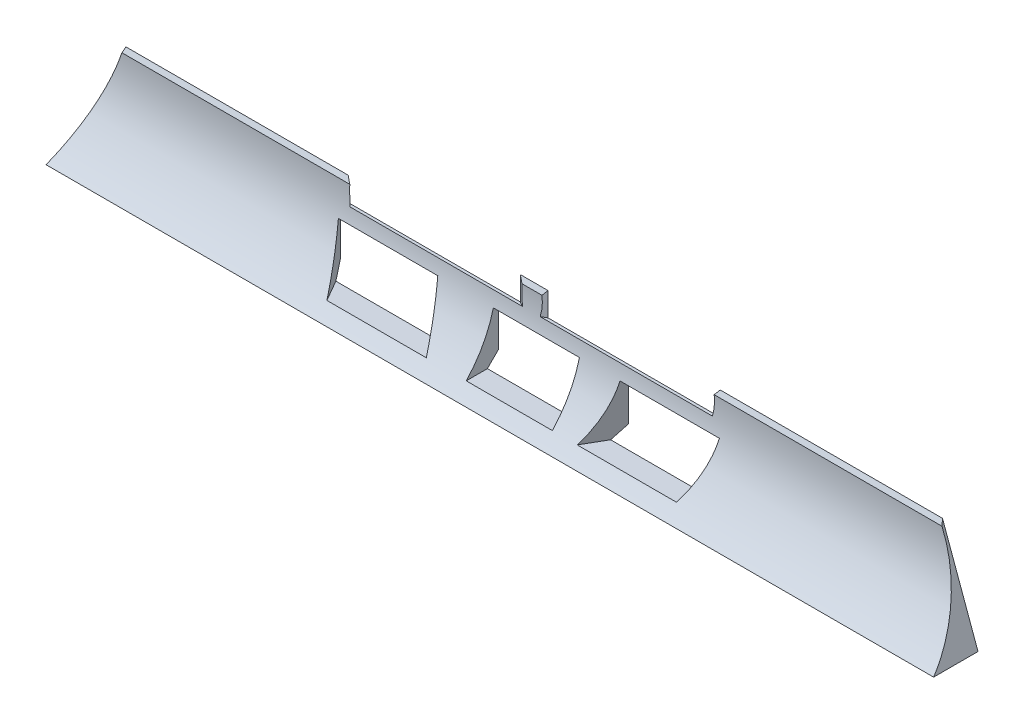
from build123d import *

# Parameters (mm, degrees)
BOSS_EXTRUDE1_DEPTH = 200
CUT_EXTRUDE1_DEPTH  = 202.45470955
CUT_EXTRUDE2_DEPTH  = 202.45470955
BOSS_EXTRUDE2_REACH = 203.455
SKETCH5_W           = 3
SKETCH5_H           = 5
CUT_EXTRUDE3_DEPTH  = 202.45470955
CUT_EXTRUDE4_DEPTH  = 1.8
SKETCH9_W           = 19.4
SKETCH9_H           = 11.2
CUT_EXTRUDE6_DEPTH  = 202.45470955
CUT_EXTRUDE8_START  = -6.8
SKETCH10_W          = 19.4
SKETCH10_H          = 11.2
CUT_EXTRUDE8_DEPTH  = 22.6
SKETCH11_W          = 19.4
SKETCH11_H          = 12.8
CUT_EXTRUDE9_DEPTH  = 97.8


with BuildPart() as part:
    # Sketch1 → Boss-Extrude1 (new body)
    with BuildSketch(Plane(origin=(0, 0, 0), x_dir=(0, 0, -1), z_dir=(1, 0, 0))):
        Polygon((0, 0), (-10, 0), (0, 22), align=None)
    extrude(amount=BOSS_EXTRUDE1_DEPTH)

    # Sketch2 → Cut-Extrude1 (cut, through all)
    with BuildSketch(Plane(origin=(200, 0, 0), x_dir=(0, 0, -1), z_dir=(1, 0, 0))):
        with BuildLine():
            Line((-10, 0), (-0.5, 20.9))
            ThreePointArc((-0.5, 20.9), (-2.709071222, 9.295032374), (-10, 0))
        make_face()
    extrude(amount=-CUT_EXTRUDE1_DEPTH, mode=Mode.SUBTRACT)

    # Sketch4 → Cut-Extrude2 (cut, through all)
    with BuildSketch(Plane(origin=(200, 0, 0), x_dir=(0, 0, -1), z_dir=(1, 0, 0))):
        Polygon((-5, 0), (0, 5), (0, 0), align=None)
    extrude(amount=-CUT_EXTRUDE2_DEPTH, mode=Mode.SUBTRACT)

    # Boss-Extrude2: up to this face of the body (flat: up to its plane)
    boss_extrude2_end = Plane(part.part.faces().sort_by_distance((100, 2.5, 2.5))[0])
    # Sketch5 → Boss-Extrude2 (add, up to the picked face)
    with BuildSketch(Plane(origin=(0, 0, 0), x_dir=(-1, 0, 0), z_dir=(0, 0, -1)), mode=Mode.PRIVATE) as boss_extrude2_sk1:
        with Locations((-198.5, 2.5)):
            Rectangle(SKETCH5_W, SKETCH5_H)
    boss_extrude2_tool1 = split(extrude(boss_extrude2_sk1.sketch, amount=-BOSS_EXTRUDE2_REACH, mode=Mode.PRIVATE), bisect_by=boss_extrude2_end, keep=Keep.BOTH, mode=Mode.PRIVATE)
    boss_extrude2 = boss_extrude2_tool1.solids().sort_by(Axis((198.5, 2.5, 0), (0, 0, 1)))[0]
    add(boss_extrude2)

    # Sketch6 → Cut-Extrude3 (cut, through all)
    with BuildSketch(Plane(origin=(0, 0, 0), x_dir=(-1, 0, 0), z_dir=(0, 0, -1))):
        Polygon((-200, 22), (-191.992654846, 22), (-200, 0), align=None)
    cut_extrude3 = extrude(amount=-CUT_EXTRUDE3_DEPTH, mode=Mode.SUBTRACT)

    # Mirror2: Boss-Extrude2, Cut-Extrude3 across plane
    add(boss_extrude2.mirror(Plane(origin=(100, 0, 0), x_dir=(0, 0, 1), z_dir=(1, 0, 0))))
    add(cut_extrude3.mirror(Plane(origin=(100, 0, 0), x_dir=(0, 0, 1), z_dir=(1, 0, 0))), mode=Mode.SUBTRACT)

    # Sketch8 → Cut-Extrude4 (cut)
    with BuildSketch(Plane(origin=(0, 0, 0), x_dir=(-1, 0, 0), z_dir=(0, 0, -1))):
        Polygon((-165.593814288, 11.1), (-169.173385956, 11.1), (-170.963171791, 8), (-169.173385956, 4.9), (-165.593814288, 4.9), (-163.804028453, 8), align=None)
    cut_extrude4 = extrude(amount=-CUT_EXTRUDE4_DEPTH, mode=Mode.SUBTRACT)

    # Sketch9 → Cut-Extrude6 (cut, through all)
    with BuildSketch(Plane.XY):
        with Locations((101.691800061, 8.065)):
            Rectangle(SKETCH9_W, SKETCH9_H)
    extrude(amount=CUT_EXTRUDE6_DEPTH, mode=Mode.SUBTRACT)

    # Sketch10 → Cut-Extrude8 (cut)
    with BuildSketch(Plane(origin=(32.580000823, 0, -56.430216736), x_dir=(0.866025403784433, 0, 0.5000000000000099), z_dir=(-0.5000000000000098, 0, 0.8660254037844329)).offset(CUT_EXTRUDE8_START)):
        with Locations((114.67709397, 8.065)):
            Rectangle(SKETCH10_W, SKETCH10_H)
    cut_extrude8 = extrude(amount=CUT_EXTRUDE8_DEPTH, mode=Mode.SUBTRACT)

    # Sketch11 → Cut-Extrude9 (cut)
    with BuildSketch(Plane(origin=(117.001713788, 0, -67.550970951), x_dir=(0.4999999999999981, -1.9080601945838373e-15, 0.8660254037844397), z_dir=(-0.8660254037844397, 3.3048572009189827e-15, 0.4999999999999981))):
        with Locations((61.259690641, 23.065)):
            Rectangle(SKETCH11_W, SKETCH11_H)
    cut_extrude9 = extrude(amount=CUT_EXTRUDE9_DEPTH, mode=Mode.SUBTRACT)

    # Mirror4: Cut-Extrude8, Cut-Extrude9 across plane
    add(cut_extrude8.mirror(Plane(origin=(100, 0, 0), x_dir=(0, 0, 1), z_dir=(1, 0, 0))), mode=Mode.SUBTRACT)
    add(cut_extrude9.mirror(Plane(origin=(100, 0, 0), x_dir=(0, 0, 1), z_dir=(1, 0, 0))), mode=Mode.SUBTRACT)

    # Mirror5: Cut-Extrude4 across plane
    add(cut_extrude4.mirror(Plane(origin=(100, 0, 0), x_dir=(0, 0, 1), z_dir=(1, 0, 0))), mode=Mode.SUBTRACT)


solid = part.part
